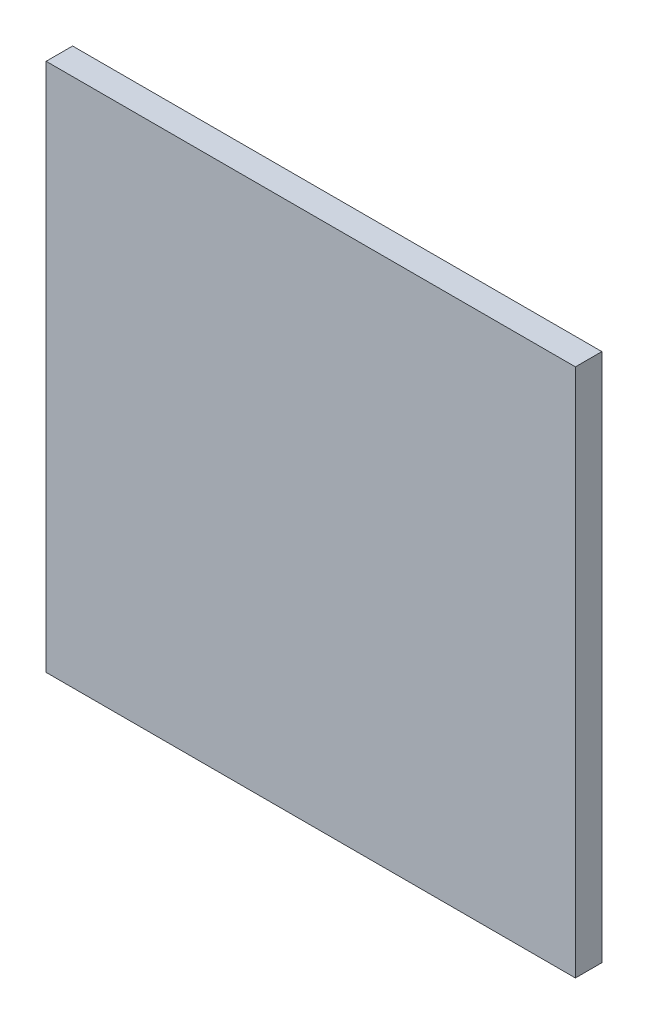
from build123d import *

# Parameters (mm, degrees)
SKETCH1_W           = 300
SKETCH1_H           = 300
BOSS_EXTRUDE1_DEPTH = 15


with BuildPart() as part:
    # Sketch1 → Boss-Extrude1 (new body)
    with BuildSketch(Plane.XY):
        with Locations((150, 150)):
            Rectangle(SKETCH1_W, SKETCH1_H)
    extrude(amount=BOSS_EXTRUDE1_DEPTH)


solid = part.part
